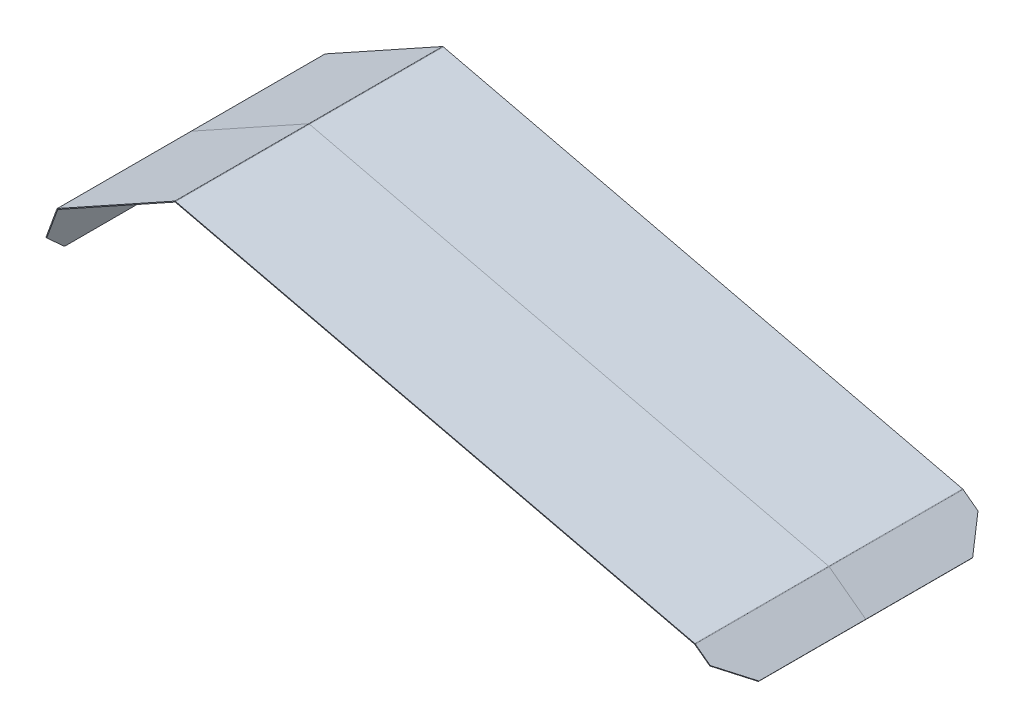
from build123d import *

# Parameters (mm, degrees)
SM_BASE_FLANGE_1_DEPTH = 248
CHAMFER_1_SIZE         = 50


# Sheet-metal steps are written as plain solids
with BuildPart() as part:
    # Sketch 1 → Базовая кромка1 (new body)
    with BuildSketch(Plane.XY):
        with BuildLine():
            Line((-631.512294125, 164.676509864), (-594.176437308, 267.255933406))
            ThreePointArc((-594.176437308, 267.255933406), (-593.774974301, 267.944409031), (-593.157874046, 268.448748705))
            Line((-593.157874046, 268.448748705), (-376.017310888, 388.866020848))
            ThreePointArc((-376.017310888, 388.866020848), (-375.23622418, 389.126182817), (-374.413902548, 389.086586981))
            Line((-374.413902548, 389.086586981), (587.555538712, 160.871606081))
            ThreePointArc((587.555538712, 160.871606081), (587.985726672, 160.721956923), (588.376749927, 160.488381743))
            Line((588.376749927, 160.488381743), (656.168217212, 109.982187653))
            Line((656.168217212, 109.982187653), (655.272053364, 108.779320098))
            Line((655.272053364, 108.779320098), (587.480586079, 159.285514187))
            ThreePointArc((587.480586079, 159.285514187), (587.351408753, 159.362677417), (587.209293088, 159.412115085))
            Line((587.209293088, 159.412115085), (-374.760148172, 387.627095985))
            ThreePointArc((-374.760148172, 387.627095985), (-375.031807997, 387.640176753), (-375.28984557, 387.554230388))
            Line((-375.28984557, 387.554230388), (-592.430408728, 267.136958245))
            ThreePointArc((-592.430408728, 267.136958245), (-592.634272205, 266.970346031), (-592.766898377, 266.742903191))
            Line((-592.766898377, 266.742903191), (-630.102755194, 164.163479649))
            Line((-630.102755194, 164.163479649), (-631.512294125, 164.676509864))
        make_face()
    extrude(amount=SM_BASE_FLANGE_1_DEPTH)

    # Фаска1
    chamfer_1_edges = [part.edges().sort_by_distance(p)[0] for p in [
        (-630.80752466, 164.419994757, 248),
        (655.720135288, 109.380753875, 248),
    ]]
    chamfer(chamfer_1_edges, length=CHAMFER_1_SIZE)


with BuildPart() as body_2:
    # Зеркальное отражение1: mirrored copy
    add(part.part.mirror(Plane(origin=(587.480586079, 159.285514187, 0), x_dir=(1, 0, 0), z_dir=(0, 0, -1))))


solid = Compound([part.part, body_2.part])
